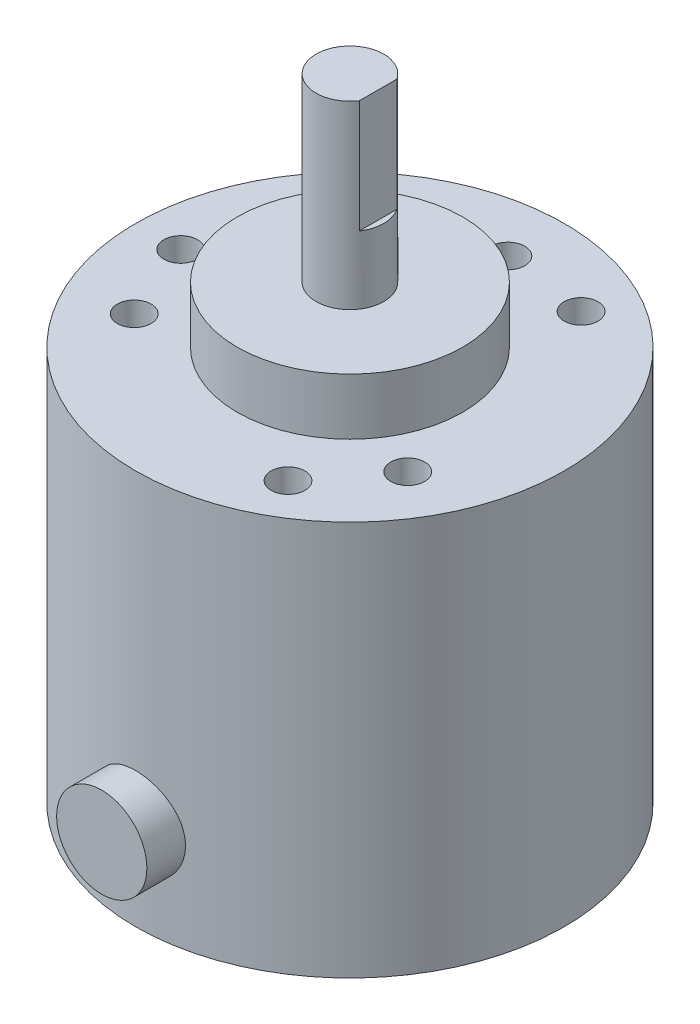
from build123d import *

# Parameters (mm, degrees)
SKETCH2_R           = 19
BOSS_EXTRUDE2_DEPTH = 35
SKETCH4_R           = 10
BOSS_EXTRUDE3_DEPTH = 5
SKETCH5_R           = 3
BOSS_EXTRUDE4_DEPTH = 16
SKETCH8_W           = 0.5
SKETCH8_H           = 6.116200225
CUT_EXTRUDE2_DEPTH  = 10
SKETCH10_R          = 1.5
CUT_EXTRUDE3_DEPTH  = 7
SKETCH15_R          = 4
BOSS_EXTRUDE5_DEPTH = 22


with BuildPart() as part:
    # Sketch2 → Boss-Extrude2 (new body)
    with BuildSketch(Plane(origin=(0, 0, 0), x_dir=(1, 0, 0), z_dir=(0, 1, 0))):
        Circle(SKETCH2_R)
    extrude(amount=-BOSS_EXTRUDE2_DEPTH)

    # Sketch4 → Boss-Extrude3 (add)
    with BuildSketch(Plane(origin=(0, 0, 0), x_dir=(1, 0, 0), z_dir=(0, 1, 0))):
        Circle(SKETCH4_R)
    extrude(amount=BOSS_EXTRUDE3_DEPTH)

    # Sketch5 → Boss-Extrude4 (add)
    with BuildSketch(Plane(origin=(0, 5, 0), x_dir=(1, 0, 0), z_dir=(0, 1, 0))):
        Circle(SKETCH5_R)
    extrude(amount=BOSS_EXTRUDE4_DEPTH)

    # Sketch8 → Cut-Extrude2 (cut)
    with BuildSketch(Plane(origin=(0, 21, 0), x_dir=(1, 0, 0), z_dir=(0, 1, 0))):
        with Locations((2.75, -0.083275924)):
            Rectangle(SKETCH8_W, SKETCH8_H)
    extrude(amount=-CUT_EXTRUDE2_DEPTH, mode=Mode.SUBTRACT)

    # Sketch10 → Cut-Extrude3 (cut)
    with BuildSketch(Plane(origin=(0, 0, 0), x_dir=(1, 0, 0), z_dir=(0, 1, 0))):
        with Locations((-15, 0)):
            Circle(SKETCH10_R)
        with Locations((0, 14)):
            Circle(SKETCH10_R)
        with Locations((7.5, 12.990381057)):
            Circle(SKETCH10_R)
        with Locations((7.5, -12.990381057)):
            Circle(SKETCH10_R)
        with Locations((12.124355653, -7)):
            Circle(SKETCH10_R)
        with Locations((-12.124355653, -7)):
            Circle(SKETCH10_R)
    extrude(amount=-CUT_EXTRUDE3_DEPTH, mode=Mode.SUBTRACT)

    # Sketch15 → Boss-Extrude5 (add)
    with BuildSketch(Plane.XY):
        with Locations((0, -27)):
            Circle(SKETCH15_R)
    extrude(amount=BOSS_EXTRUDE5_DEPTH)


solid = part.part
